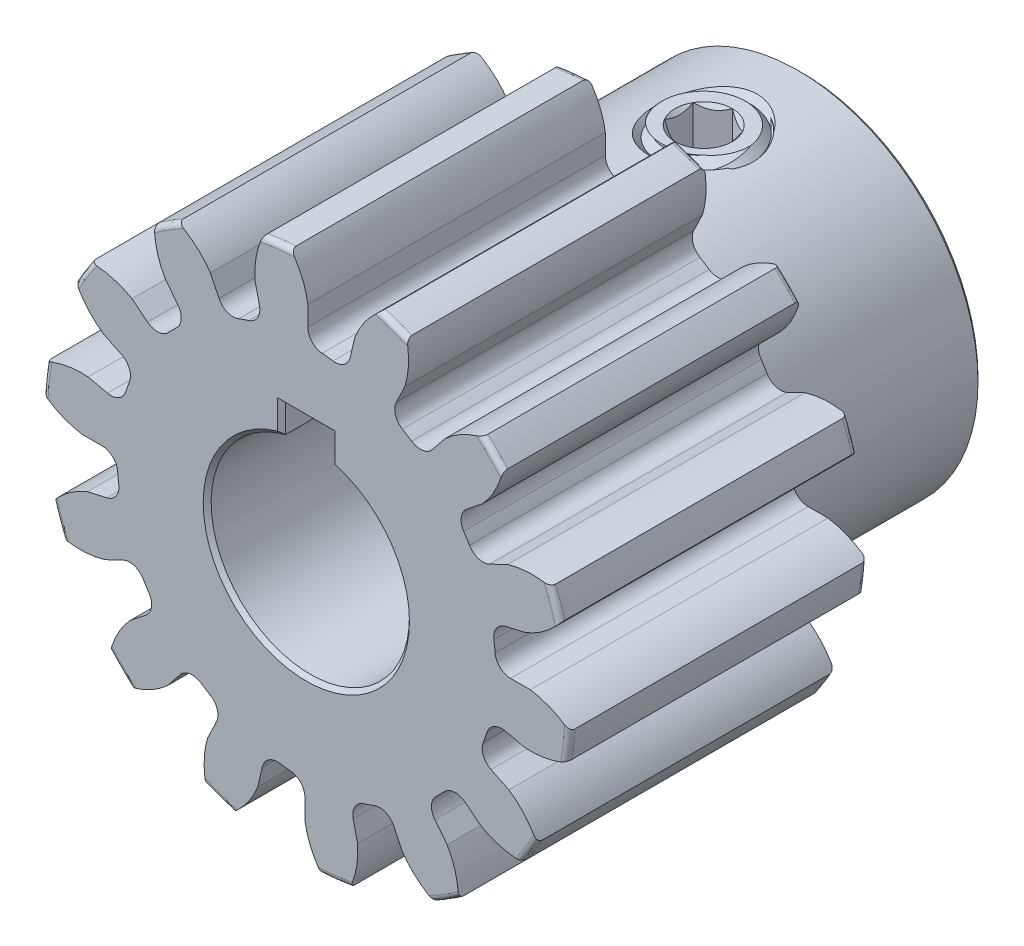
from build123d import *

# Parameters (mm, degrees)
SKETCH1_R                = 16.891
BOSS_EXTRUDE1_DEPTH      = 19.05
SKETCH2_W                = 12.7
SKETCH2_H                = 11.509375
FILLET2_R                = 0.33782
CUT_EXTRUDE1_DEPTH       = 40.732534092
FILLET1_R                = 0.997742988
CIRPATTERN1_COUNT        = 14
FILLET1_OF_CIRPATTERN1_R = 0.997742988
SKETCH5_R                = 6.35
CUT_EXTRUDE2_DEPTH       = 40.707890562
SKETCH6_W                = 3.175
SKETCH6_H                = 1.789138938
CUT_EXTRUDE3_DEPTH       = 40.707890562
CHAMFER2_SIZE            = 0.254
SKETCH8_W                = 11.509375
SKETCH8_H                = 3.175
CUT_SWEEP1_PITCH         = 1.27
SKETCH12_W               = 3.175
SKETCH12_H               = 6.35
CHAMFER3_SIZE            = 0.508
CUT_SWEEP2_PITCH         = 1.27
CUT_EXTRUDE4_DEPTH       = 3.175


with BuildPart() as part:
    # Sketch1 → Boss-Extrude1 (new body)
    with BuildSketch(Plane.XY):
        Circle(SKETCH1_R)
    extrude(amount=-BOSS_EXTRUDE1_DEPTH)

    # Sketch2 → Revolve1 (revolve)
    with BuildSketch(Plane(origin=(0, 0, 0), x_dir=(0, 0, -1), z_dir=(1, 0, 0)), mode=Mode.PRIVATE) as revolve1_sk:
        with Locations((25.4, 5.7546875)):
            Rectangle(SKETCH2_W, SKETCH2_H)
    revolve(revolve1_sk.sketch.rotate(Axis((0, 0, -19.05), (0, 0, -1)), 90), axis=Axis((0, 0, -19.05), (0, 0, -1)))

    # Fillet2
    fillet2_edges = [part.edges().sort_by_distance(p)[0] for p in [
        (-16.891, 0, 0),
        (-16.891, 0, -19.05),
        (-11.509375, 0, -19.05),
    ]]
    fillet(fillet2_edges, radius=FILLET2_R)

    # Sketch4 → Cut-Extrude1 (cut, through all)
    with BuildSketch(Plane.XY):
        with BuildLine():
            Line((0.09320492, 14.348516647), (0.09320492, 12.12678111))
            ThreePointArc((0.09320492, 12.12678111), (1.357811959, 12.050886023), (2.607600795, 11.843476067))
            Line((2.607600795, 11.843476067), (3.101984599, 14.009507795))
            add(Edge.make_bspline(
                [(5.313516514, 16.659335957), (3.73891971, 15.626348552), (3.101984599, 14.009507795)],
                knots=[0, 0, 0, 1, 1, 1], degree=2))
            ThreePointArc((5.313516514, 16.659335957), (1.957836955, 17.376242595), (-1.473235422, 17.424021053))
            add(Edge.make_bspline(
                [(-1.473235422, 17.424021053), (-0.167979082, 16.066551363), (0.09320492, 14.348516647)],
                knots=[0, 0, 0, 1, 1, 1], degree=2))
        make_face()
    cut_extrude1 = extrude(amount=-CUT_EXTRUDE1_DEPTH, mode=Mode.SUBTRACT)

    # Fillet1
    fillet1_edges = [part.edges().sort_by_distance(p)[0] for p in [
        (2.607600795, 11.843476067, -9.525),
        (0.09320492, 12.12678111, -9.525),
    ]]
    fillet(fillet1_edges, radius=FILLET1_R)

    # CirPattern1: Cut-Extrude1 ×14 about axis
    cirpattern1_axis = Axis((0, 0, -19.05), (0, 0, 1))
    for i in range(1, CIRPATTERN1_COUNT):
        add(cut_extrude1.rotate(cirpattern1_axis, i * 360 / CIRPATTERN1_COUNT), mode=Mode.SUBTRACT)

    # Fillet1 of CirPattern1
    fillet1_of_cirpattern1_edges = [part.edges().sort_by_distance(p)[0] for p in [
        (-2.789324544, 11.801998807, -9.525),
        (-5.1776384, 10.966292347, -9.525),
        (-7.633789948, 9.422990942, -9.525),
        (-9.422986936, 7.633794892, -9.525),
        (-10.966289631, 5.177644155, -9.525),
        (-11.801997344, 2.789330737, -9.525),
        (-12.126781159, -0.093198556, -9.525),
        (-11.843477435, -2.607594581, -9.525),
        (-10.885414954, -5.345582151, -9.525),
        (-9.53921157, -7.488053811, -9.525),
        (-7.488058817, -9.539207641, -9.525),
        (-5.345587863, -10.885412149, -9.525),
        (-2.607600795, -11.843476067, -9.525),
        (-0.09320492, -12.12678111, -9.525),
        (2.789324544, -11.801998807, -9.525),
        (5.1776384, -10.966292347, -9.525),
        (7.633789948, -9.422990942, -9.525),
        (9.422986936, -7.633794892, -9.525),
        (10.966289631, -5.177644155, -9.525),
        (11.801997344, -2.789330737, -9.525),
        (12.126781159, 0.093198556, -9.525),
        (11.843477435, 2.607594581, -9.525),
        (10.885414954, 5.345582151, -9.525),
        (9.53921157, 7.488053811, -9.525),
        (7.488058817, 9.539207641, -9.525),
        (5.345587863, 10.885412149, -9.525),
    ]]
    fillet(fillet1_of_cirpattern1_edges, radius=FILLET1_OF_CIRPATTERN1_R)

    # Sketch5 → Cut-Extrude2 (cut, through all)
    with BuildSketch(Plane.XY):
        Circle(SKETCH5_R)
    extrude(amount=-CUT_EXTRUDE2_DEPTH, mode=Mode.SUBTRACT)

    # Sketch6 → Cut-Extrude3 (cut, through all)
    with BuildSketch(Plane.XY):
        with Locations((0, 7.042930531)):
            Rectangle(SKETCH6_W, SKETCH6_H)
    extrude(amount=-CUT_EXTRUDE3_DEPTH, mode=Mode.SUBTRACT)

    # Chamfer2
    chamfer2_edges = [part.edges().sort_by_distance(p)[0] for p in [
        (-11.509375, 0, -31.75),
        (0, -6.35, -31.75),
        (0, -6.35, 0),
        (1.5875, 7.042930531, 0),
        (0, 7.9375, 0),
        (-1.5875, 7.042930531, 0),
        (1.5875, 7.042930531, -31.75),
        (-1.5875, 7.042930531, -31.75),
        (0, 7.9375, -31.75),
    ]]
    chamfer(chamfer2_edges, length=CHAMFER2_SIZE)


with BuildPart() as body_2:
    # Sketch8 → Revolve2 (revolve)
    with BuildSketch(Plane(origin=(0, 0, 0), x_dir=(0, -1, 0), z_dir=(1, 0, 0)), mode=Mode.PRIVATE) as revolve2_sk:
        with Locations((-5.7546875, 27.02941)):
            Rectangle(SKETCH8_W, SKETCH8_H)
    revolve(revolve2_sk.sketch.rotate(Axis((0, 11.509375, -25.44191), (0, -1, 0)), 180), axis=Axis((0, 11.509375, -25.44191), (0, -1, 0)))

    # Cut-Sweep1: arcs per turn and ends read off the stored shape
    # Cut-Sweep1: the profile of Sketch11 profile screwed along a right-hand helix through 11 turns, 8 arcs to a turn; built about Z, then put on its axis
    cut_sweep1_z = Axis((0, 0, 0), (0, 0, 1))
    cut_sweep1_corners = [(3.1753, 0, -1.269826795), (3.1753, 0, -2.381423205), (2.350110803, 0, -1.905), (2.350110803, 0, -1.74625)]
    with BuildLine(mode=Mode.PRIVATE) as cut_sweep1_profile:
        Line(cut_sweep1_corners[0], cut_sweep1_corners[1])
        Line(cut_sweep1_corners[1], cut_sweep1_corners[2])
        Line(cut_sweep1_corners[2], cut_sweep1_corners[3])
        Line(cut_sweep1_corners[3], cut_sweep1_corners[0])
    cut_sweep1_cap = Face(cut_sweep1_profile.wire())
    cut_sweep1_turn_angles = [0, 22.5, 45, 67.5, 90, 112.5, 135, 157.5, 180, 202.5, 225, 247.5, 270, 292.5, 315, 337.5, 360]
    cut_sweep1_turn_weights = [1, 0.9238795325112867, 1, 0.9238795325112867, 1, 0.9238795325112867, 1, 0.9238795325112867, 1, 0.9238795325112867, 1, 0.9238795325112867, 1, 0.9238795325112867, 1, 0.9238795325112867, 1]
    cut_sweep1_turn_rails = [Edge.make_bspline([Vector(p[0], p[1], 0).rotate(cut_sweep1_z, cut_sweep1_turn_angles[k]) / cut_sweep1_turn_weights[k] + Vector(0, 0, p[2] + CUT_SWEEP1_PITCH * cut_sweep1_turn_angles[k] / 360) for k in range(17)], [0, 0, 0, 1, 1, 2, 2, 3, 3, 4, 4, 5, 5, 6, 6, 7, 7, 8, 8, 8], 2, cut_sweep1_turn_weights) for p in cut_sweep1_corners]
    cut_sweep1_turn_sides = [Face.make_surface_from_curves(cut_sweep1_turn_rails[p[0]], cut_sweep1_turn_rails[p[1]]) for p in [(0, 1), (1, 2), (2, 3), (3, 0)]]
    cut_sweep1 = Plane(origin=(0, 11.509375, -25.44191), x_dir=(0, 0, -1), z_dir=(0, -1, 0)) * Solid(Shell([*[p.moved(Location((0, 0, CUT_SWEEP1_PITCH * i))) for i in range(11) for p in cut_sweep1_turn_sides], cut_sweep1_cap, cut_sweep1_cap.rotate(cut_sweep1_z, 3960).moved(Location((0, 0, CUT_SWEEP1_PITCH * 3960 / 360)))]))
    add(cut_sweep1, mode=Mode.SUBTRACT)

    # Boss-Extrude2 cone 1 section (through the dimple's axis) → Boss-Extrude2 (revolve)
    with BuildSketch(Plane(origin=(0, 11.509375, -25.44191), x_dir=(0, 0, 1), z_dir=(1, 0, 0))):
        Polygon((0, 0), (3.429, 0), (0, 3.429), align=None)
    revolve(axis=Axis((0, 11.509375, -25.44191), (0, -1, 0)))


with BuildPart() as part_1:
    add(part.part)

    # Combine1: cut body 2
    add(body_2.part, mode=Mode.SUBTRACT)


with BuildPart() as body_2_2:
    # Sketch12 → Revolve3 (revolve)
    with BuildSketch(Plane(origin=(0, 0, 0), x_dir=(0, 0, -1), z_dir=(1, 0, 0))):
        with Locations((27.02941, 8.334375)):
            Rectangle(SKETCH12_W, SKETCH12_H)
    revolve(axis=Axis((0, 5.159375, -25.44191), (0, 1, 0)))

    # Chamfer3
    chamfer3_edges = [body_2_2.edges().sort_by_distance(p)[0] for p in [
        (0, 5.159375, -22.26691),
        (0, 11.509375, -22.26691),
    ]]
    chamfer(chamfer3_edges, length=CHAMFER3_SIZE)

    # Cut-Sweep2: arcs per turn and ends read off the stored shape
    # Cut-Sweep2: the profile of Sketch15 profile screwed along a right-hand helix through 11 turns, 8 arcs to a turn; built about Z, then put on its axis
    cut_sweep2_z = Axis((0, 0, 0), (0, 0, 1))
    cut_sweep2_corners = [(3.1753, 0, -1.269826795), (3.1753, 0, -2.381423205), (2.350110803, 0, -1.905), (2.350110803, 0, -1.74625)]
    with BuildLine(mode=Mode.PRIVATE) as cut_sweep2_profile:
        Line(cut_sweep2_corners[0], cut_sweep2_corners[1])
        Line(cut_sweep2_corners[1], cut_sweep2_corners[2])
        Line(cut_sweep2_corners[2], cut_sweep2_corners[3])
        Line(cut_sweep2_corners[3], cut_sweep2_corners[0])
    cut_sweep2_cap = Face(cut_sweep2_profile.wire())
    cut_sweep2_turn_angles = [0, 22.5, 45, 67.5, 90, 112.5, 135, 157.5, 180, 202.5, 225, 247.5, 270, 292.5, 315, 337.5, 360]
    cut_sweep2_turn_weights = [1, 0.9238795325112867, 1, 0.9238795325112867, 1, 0.9238795325112867, 1, 0.9238795325112867, 1, 0.9238795325112867, 1, 0.9238795325112867, 1, 0.9238795325112867, 1, 0.9238795325112867, 1]
    cut_sweep2_turn_rails = [Edge.make_bspline([Vector(p[0], p[1], 0).rotate(cut_sweep2_z, cut_sweep2_turn_angles[k]) / cut_sweep2_turn_weights[k] + Vector(0, 0, p[2] + CUT_SWEEP2_PITCH * cut_sweep2_turn_angles[k] / 360) for k in range(17)], [0, 0, 0, 1, 1, 2, 2, 3, 3, 4, 4, 5, 5, 6, 6, 7, 7, 8, 8, 8], 2, cut_sweep2_turn_weights) for p in cut_sweep2_corners]
    cut_sweep2_turn_sides = [Face.make_surface_from_curves(cut_sweep2_turn_rails[p[0]], cut_sweep2_turn_rails[p[1]]) for p in [(0, 1), (1, 2), (2, 3), (3, 0)]]
    cut_sweep2 = Plane(origin=(0, 11.509375, -25.44191), x_dir=(0, 0, -1), z_dir=(0, -1, 0)) * Solid(Shell([*[p.moved(Location((0, 0, CUT_SWEEP2_PITCH * i))) for i in range(11) for p in cut_sweep2_turn_sides], cut_sweep2_cap, cut_sweep2_cap.rotate(cut_sweep2_z, 3960).moved(Location((0, 0, CUT_SWEEP2_PITCH * 3960 / 360)))]))
    add(cut_sweep2, mode=Mode.SUBTRACT)

    # Sketch16 → Cut-Extrude4 (cut)
    with BuildSketch(Plane(origin=(0, 11.509375, 0), x_dir=(1, 0, 0), z_dir=(0, 1, 0))):
        Polygon((0, 27.274997105), (-1.5875, 26.358453552), (-1.5875, 24.525366448), (0, 23.608822895), (1.5875, 24.525366448), (1.5875, 26.358453552), align=None)
    extrude(amount=-CUT_EXTRUDE4_DEPTH, mode=Mode.SUBTRACT)

    # Cut-Extrude5 cone 1 section (through the dimple's axis) → Cut-Extrude5 (revolve, cut)
    with BuildSketch(Plane(origin=(0, 11.509375, -25.44191), x_dir=(0, 0, 1), z_dir=(1, 0, 0))):
        Polygon((0, 0), (1.833087105, 0), (0, 1.833087105), align=None)
    revolve(axis=Axis((0, 11.509375, -25.44191), (0, -1, 0)), mode=Mode.SUBTRACT)

    # Cut-Extrude6 cone 1 section (through the dimple's axis) → Cut-Extrude6 (revolve, cut)
    with BuildSketch(Plane(origin=(0, 8.334375, -25.44191), x_dir=(0, 0, 1), z_dir=(1, 0, 0))):
        Polygon((0, 0), (1.5875, 0), (0, 0.916543552), align=None)
    revolve(axis=Axis((0, 8.334375, -25.44191), (0, -1, 0)), mode=Mode.SUBTRACT)


solid = Compound([part_1.part, body_2_2.part])
